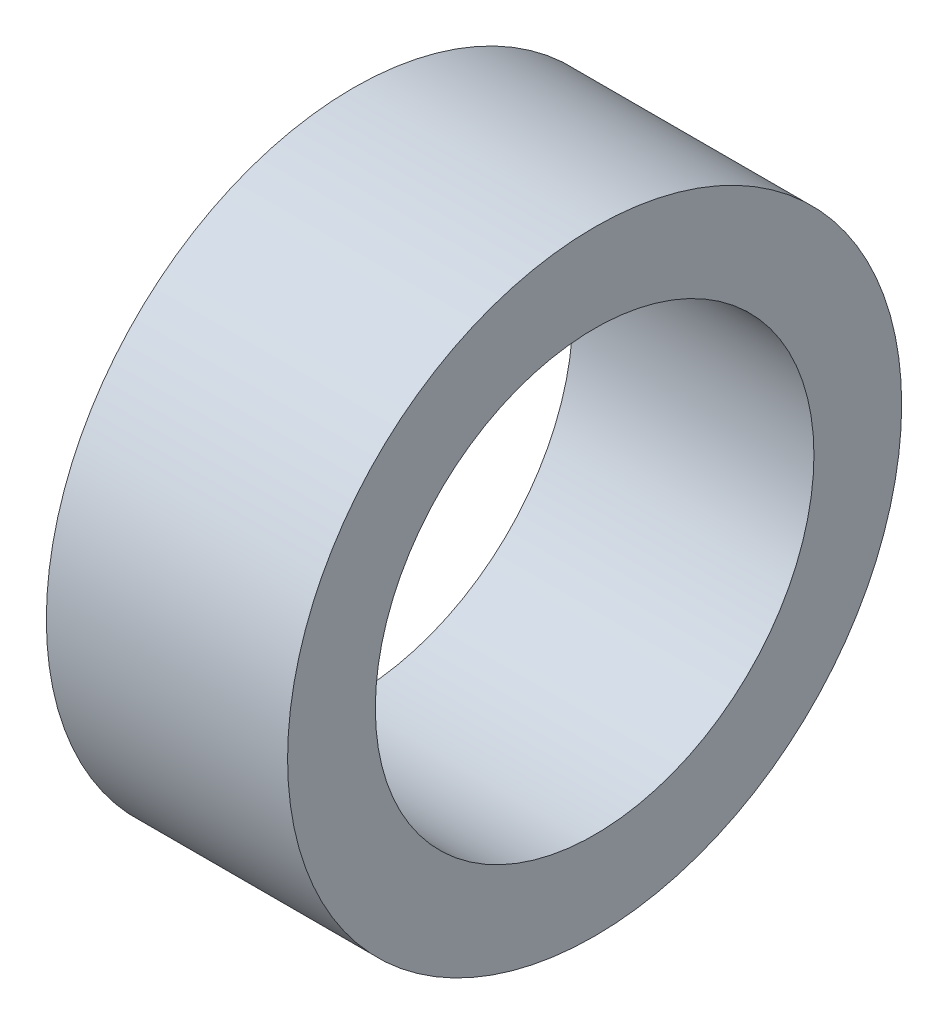
from build123d import *

# Parameters (mm, degrees)
SKETCH1_W = 5.5
SKETCH1_H = 2


with BuildPart() as part:
    # Sketch1 → Revolve1 (revolve)
    with BuildSketch(Plane.XY):
        with Locations((23.75, 6)):
            Rectangle(SKETCH1_W, SKETCH1_H)
    revolve(axis=Axis((21, 0, 0), (1, 0, 0)))


solid = part.part
